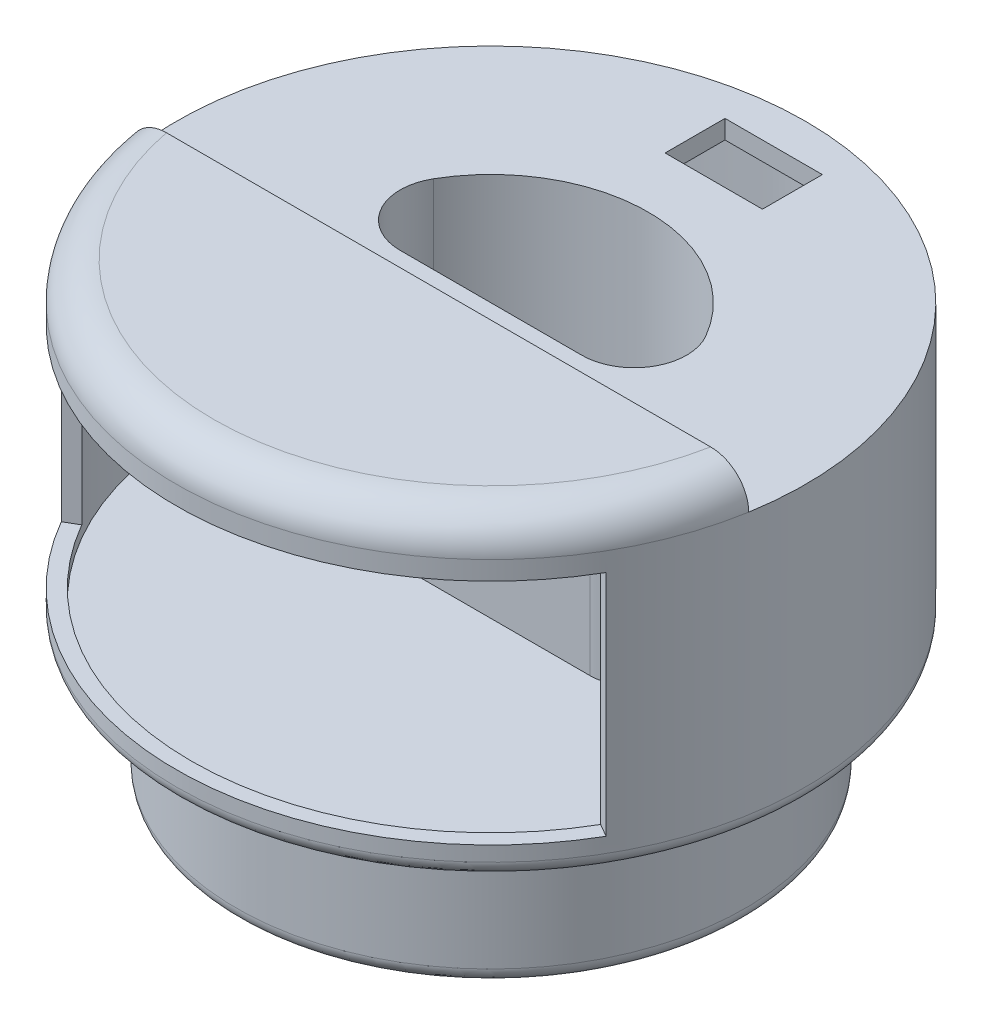
from build123d import *

# Parameters (mm, degrees)
CUT_EXTRUDE1_DEPTH  = 5
CUT_EXTRUDE3_DEPTH  = 45
SKETCH8_R           = 40
CUT_EXTRUDE4_DEPTH  = 32
SKETCH9_R           = 32
SKETCH9_R_2         = 24.5
CUT_EXTRUDE5_DEPTH  = 14
SKETCH10_R          = 26
CUT_EXTRUDE6_DEPTH  = 14
FILLET1_R           = 7
FILLET2_R           = 7
CUT_REVOLVE1_START  = 22
CUT_REVOLVE1_DEPTH  = 30.5
CUT_EXTRUDE12_DEPTH = 5
SKETCH18_W          = 13
SKETCH18_H          = 8
CUT_EXTRUDE13_DEPTH = 5
SKETCH20_W          = 84
SKETCH20_H          = 7
CUT_EXTRUDE15_DEPTH = 5
SKETCH19_R          = 1.35
CUT_EXTRUDE14_DEPTH = 8


# Read off the part's stored shape, not the designer's step: Cut-Revolve1
with BuildPart() as part:
    # Sketch1 → Revolve1 (revolve)
    with BuildSketch(Plane.XY, mode=Mode.PRIVATE) as revolve1_sk:
        with BuildLine():
            Line((22.5, 0), (32, 0))
            ThreePointArc((32, 0), (33.414213562, 0.585786438), (34, 2))
            Line((34, 2), (34, 18))
            Line((34, 18), (40, 18))
            ThreePointArc((40, 18), (41.414213562, 18.585786438), (42, 20))
            Line((42, 20), (42, 55))
            ThreePointArc((42, 55), (40.535533906, 58.535533906), (37, 60))
            Line((37, 60), (0, 60))
            Line((0, 60), (0, 18))
            Line((0, 18), (22.5, 18))
            Line((22.5, 18), (22.5, 0))
        make_face()
    revolve(revolve1_sk.sketch.rotate(Axis((0, 2, 0), (0, 1, 0)), 90), axis=Axis((0, 2, 0), (0, 1, 0)))

    # Sketch5 → Cut-Extrude1 (cut)
    with BuildSketch(Plane(origin=(0, 60, 0), x_dir=(1, 0, 0), z_dir=(0, 1, 0))):
        with BuildLine():
            Line((-42, 0), (-40, 0))
            Line((-40, 0), (40, 0))
            Line((40, 0), (42, 0))
            ThreePointArc((42, 0), (0, 42), (-42, 0))
        make_face()
    extrude(amount=-CUT_EXTRUDE1_DEPTH, mode=Mode.SUBTRACT)

    # Sketch7 → Cut-Extrude3 (cut)
    with BuildSketch(Plane.XZ.offset(-18)):
        with BuildLine():
            Line((-21, 0), (21, 0))
            ThreePointArc((21, 0), (0, -21), (-21, 0))
        make_face()
    extrude(amount=-CUT_EXTRUDE3_DEPTH, mode=Mode.SUBTRACT)

    # Sketch8 → Cut-Extrude4 (cut)
    with BuildSketch(Plane(origin=(0, 52.5, 0), x_dir=(1, 0, 0), z_dir=(0, 1, 0))):
        with Locations(Location((0, 0, 0), (0, 0, 270))):
            Circle(SKETCH8_R)
        with BuildLine():
            Line((22.912878475, -2), (-22.912878475, -2))
            ThreePointArc((-22.912878475, -2), (0, 23), (22.912878475, -2))
        make_face(mode=Mode.SUBTRACT)
    extrude(amount=-CUT_EXTRUDE4_DEPTH, mode=Mode.SUBTRACT)

    # Sketch9 → Cut-Extrude5 (cut)
    with BuildSketch(Plane(origin=(0, 2, 0), x_dir=(-1, 0, 0), z_dir=(0, -1, 0))):
        with Locations(Location((0, 0, 0), (0, 0, 90))):
            Circle(SKETCH9_R)
        with Locations(Location((0, 0, 0), (0, 0, 90))):
            Circle(SKETCH9_R_2, mode=Mode.SUBTRACT)
    extrude(amount=-CUT_EXTRUDE5_DEPTH, mode=Mode.SUBTRACT)

    # Sketch10 → Cut-Extrude6 (cut)
    with BuildSketch(Plane(origin=(0, 2, 0), x_dir=(-1, 0, 0), z_dir=(0, -1, 0))):
        Circle(SKETCH10_R)
    extrude(amount=-CUT_EXTRUDE6_DEPTH, mode=Mode.SUBTRACT)

    # Fillet1
    fillet1_edges = [part.edges().sort_by_distance(p)[0] for p in [
        (21, 36.5, 0),
        (-21, 36.5, 0),
    ]]
    fillet(fillet1_edges, radius=FILLET1_R)

    # Fillet2
    fillet2_edges = [part.edges().sort_by_distance(p)[0] for p in [
        (-22.912878475, 36.5, 2),
        (22.912878475, 36.5, 2),
    ]]
    fillet(fillet2_edges, radius=FILLET2_R)

    # Cut-Revolve1 outline → Cut-Revolve1 (cut)
    with BuildSketch(Plane(origin=(0, 0, 0), x_dir=(1, 0, 0), z_dir=(0, 1, 0)).offset(CUT_REVOLVE1_START)):
        with BuildLine():
            Line((-34.641016151, -20), (-36.373066959, -21))
            ThreePointArc((-36.373066959, -21), (0, -42), (36.373066959, -21))
            Line((36.373066959, -21), (34.641016151, -20))
            ThreePointArc((34.641016151, -20), (0, -40), (-34.641016151, -20))
        make_face()
    extrude(amount=CUT_REVOLVE1_DEPTH, mode=Mode.SUBTRACT)

    # Sketch15 → Cut-Extrude12 (cut)
    with BuildSketch(Plane(origin=(0, 20.5, 0), x_dir=(1, 0, 0), z_dir=(0, 1, 0))):
        with BuildLine():
            Line((-28.124355653, -3.514579578), (-26.124355653, -3.514579578))
            ThreePointArc((-26.124355653, -3.514579578), (-24.710142091, -2.928793141), (-24.124355653, -1.514579578))
            Line((-24.124355653, -1.514579578), (-24.124355653, 8.485420422))
            ThreePointArc((-24.124355653, 8.485420422), (-24.710142091, 9.899633984), (-26.124355653, 10.485420422))
            Line((-26.124355653, 10.485420422), (-28.124355653, 10.485420422))
            ThreePointArc((-28.124355653, 10.485420422), (-29.538569215, 9.899633984), (-30.124355653, 8.485420422))
            Line((-30.124355653, 8.485420422), (-30.124355653, -1.514579578))
            ThreePointArc((-30.124355653, -1.514579578), (-29.538569215, -2.928793141), (-28.124355653, -3.514579578))
        make_face()
    extrude(amount=-CUT_EXTRUDE12_DEPTH, mode=Mode.SUBTRACT)

    # Sketch18 → Cut-Extrude13 (cut)
    with BuildSketch(Plane(origin=(0, 55, 0), x_dir=(1, 0, 0), z_dir=(0, 1, 0))):
        with Locations((0.796512215, 32.951769165)):
            Rectangle(SKETCH18_W, SKETCH18_H)
    extrude(amount=-CUT_EXTRUDE13_DEPTH, mode=Mode.SUBTRACT)

    # Sketch20 → Cut-Extrude15 (cut)
    with BuildSketch(Plane(origin=(0, 60, 0), x_dir=(1, 0, 0), z_dir=(0, 1, 0))):
        with Locations((0, -3.5)):
            Rectangle(SKETCH20_W, SKETCH20_H)
    extrude(amount=-CUT_EXTRUDE15_DEPTH, mode=Mode.SUBTRACT)

    # Sketch19 → Cut-Extrude14 (cut)
    with BuildSketch(Plane(origin=(0, 0, 7), x_dir=(-1, 0, 0), z_dir=(0, 0, -1))):
        with Locations((0, 57.5)):
            Circle(SKETCH19_R)
        with Locations((-29.412558482, 57.5)):
            Circle(SKETCH19_R)
        with Locations((29.412558482, 57.5)):
            Circle(SKETCH19_R)
    extrude(amount=-CUT_EXTRUDE14_DEPTH, mode=Mode.SUBTRACT)


solid = part.part
